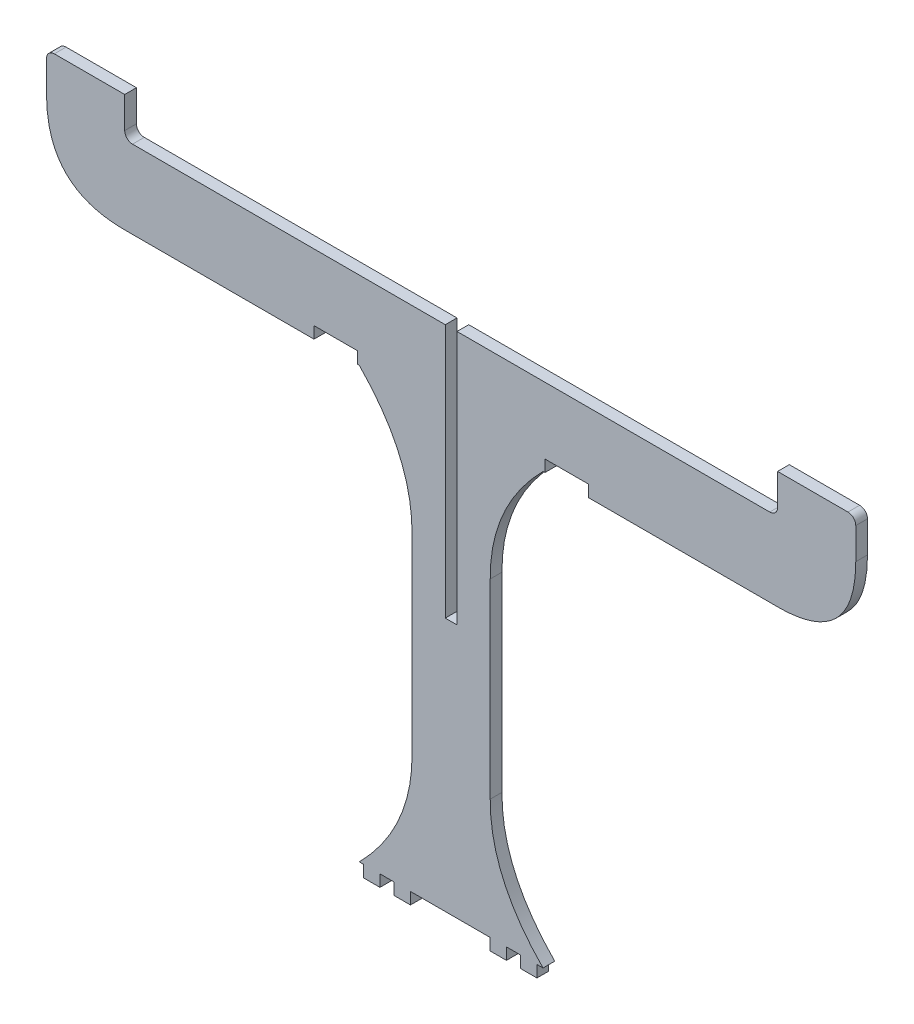
from build123d import *

# Parameters (mm, degrees)
P_IDAT_VYSUNUT_M2_DEPTH  = 3
SKICA4_W                 = 3
SKICA4_H                 = 65
SKICA4_W_2               = 11.08
SKICA4_H_2               = 11.388513514
ODEBRAT_VYSUNUT_M2_DEPTH = 3


with BuildPart() as part:
    # Skica1 → Přidat vysunutím2 (new body)
    with BuildSketch(Plane.XY):
        with BuildLine():
            Line((-90.642636358, 2.694256757), (-30.642636358, 2.694256757))
            add(Edge.make_bspline(
                [(-30.642636358, 2.694256757), (-17.025139471, -11.118063286), (-17.142636358, -27.878389443)],
                knots=[0, 0, 0, 1, 1, 1], degree=2))
            Line((-17.142636358, -27.878389443), (-17.142636358, -76.655981804))
            add(Edge.make_bspline(
                [(-30.642636358, -107.305743243), (-17.009316786, -93.458261678), (-17.142636358, -76.655981804)],
                knots=[0, 0, 0, 1, 1, 1], degree=2))
            Line((-30.642636358, -107.305743243), (-29.497972973, -107.305743243))
            Line((-29.497972973, -107.305743243), (-29.497972973, -110.305743243))
            Line((-29.497972973, -110.305743243), (-25.347972973, -110.305743243))
            Line((-25.347972973, -110.305743243), (-25.347972973, -107.305743243))
            Line((-25.347972973, -107.305743243), (-21.697972973, -107.305743243))
            Line((-21.697972973, -107.305743243), (-21.697972973, -110.305743243))
            Line((-21.697972973, -110.305743243), (-17.547972973, -110.305743243))
            Line((-17.547972973, -110.305743243), (-17.547972973, -107.305743243))
            Line((-17.547972973, -107.305743243), (2.852027027, -107.305743243))
            Line((2.852027027, -107.305743243), (2.852027027, -110.305743243))
            Line((2.852027027, -110.305743243), (7.002027027, -110.305743243))
            Line((7.002027027, -110.305743243), (7.002027027, -107.305743243))
            Line((7.002027027, -107.305743243), (10.652027027, -107.305743243))
            Line((10.652027027, -107.305743243), (10.652027027, -110.305743243))
            Line((10.652027027, -110.305743243), (14.802027027, -110.305743243))
            Line((14.802027027, -110.305743243), (14.802027027, -107.305743243))
            Line((14.802027027, -107.305743243), (16.357363642, -107.305743243))
            add(Edge.make_bspline(
                [(16.357363642, -107.305743243), (2.72404407, -93.458261678), (2.857363642, -76.655981804)],
                knots=[0, 0, 0, 1, 1, 1], degree=2))
            Line((2.857363642, -76.655981804), (2.857363642, -27.878389443))
            add(Edge.make_bspline(
                [(16.357363642, 2.694256757), (2.739866756, -11.118063286), (2.857363642, -27.878389443)],
                knots=[0, 0, 0, 1, 1, 1], degree=2))
            Line((16.357363642, 2.694256757), (76.357363642, 2.694256757))
            add(Edge.make_bspline(
                [(96.357363642, 22.694256757), (96.357363642, 2.694256757), (76.357363642, 2.694256757)],
                knots=[0, 0, 0, 1, 1, 1], degree=2))
            Line((96.357363642, 22.694256757), (96.357363642, 30.694256757))
            ThreePointArc((96.357363642, 30.694256757), (95.771577204, 32.108470319), (94.357363642, 32.694256757))
            Line((94.357363642, 32.694256757), (76.357363642, 32.694256757))
            Line((76.357363642, 32.694256757), (76.357363642, 24.694256757))
            ThreePointArc((76.357363642, 24.694256757), (75.771577204, 23.280043194), (74.357363642, 22.694256757))
            Line((74.357363642, 22.694256757), (-88.642636358, 22.694256757))
            ThreePointArc((-88.642636358, 22.694256757), (-90.05684992, 23.280043194), (-90.642636358, 24.694256757))
            Line((-90.642636358, 24.694256757), (-90.642636358, 32.694256757))
            Line((-90.642636358, 32.694256757), (-108.642636358, 32.694256757))
            ThreePointArc((-108.642636358, 32.694256757), (-110.05684992, 32.108470319), (-110.642636358, 30.694256757))
            Line((-110.642636358, 30.694256757), (-110.642636358, 22.694256757))
            add(Edge.make_bspline(
                [(-110.642636358, 22.694256757), (-110.642636358, 2.694256757), (-90.642636358, 2.694256757)],
                knots=[0, 0, 0, 1, 1, 1], degree=2))
        make_face()
    extrude(amount=P_IDAT_VYSUNUT_M2_DEPTH)

    # Skica4 → Odebrat vysunutím2 (cut)
    with BuildSketch(Plane(origin=(0, 0, 0), x_dir=(-1, 0, 0), z_dir=(0, 0, -1))):
        with Locations((7.142636358, -9.805743243)):
            Rectangle(SKICA4_W, SKICA4_H)
        with Locations((36.682636358, 0)):
            Rectangle(SKICA4_W_2, SKICA4_H_2)
        with Locations((-22.397363642, 0)):
            Rectangle(SKICA4_W_2, SKICA4_H_2)
    extrude(amount=-ODEBRAT_VYSUNUT_M2_DEPTH, mode=Mode.SUBTRACT)


solid = part.part
